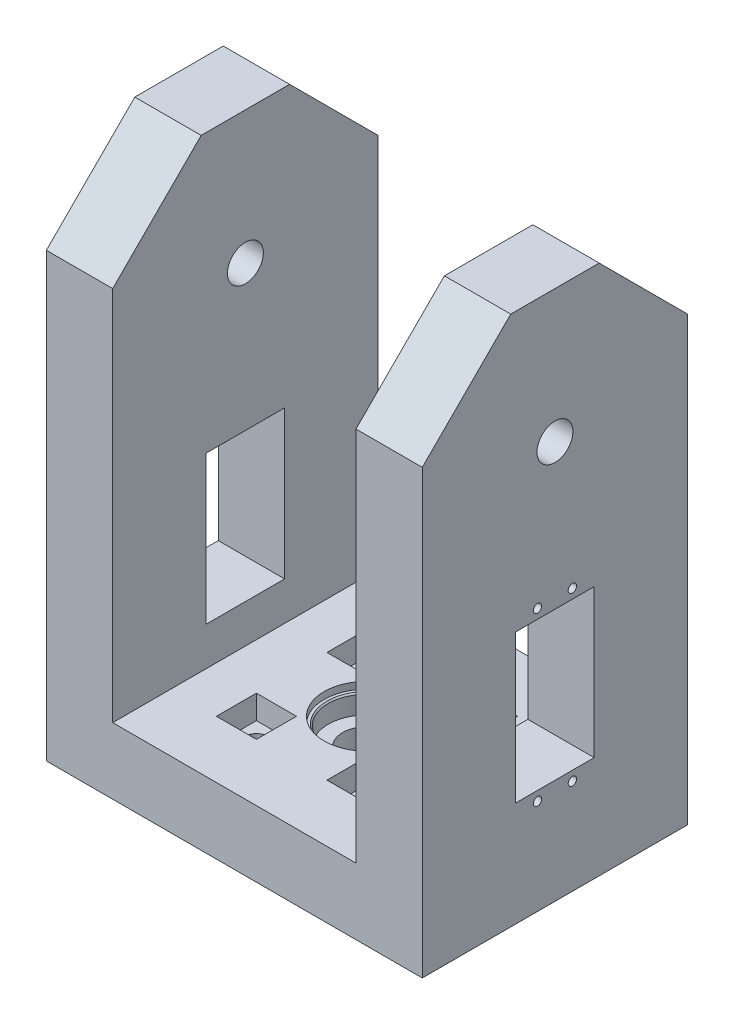
from build123d import *

# Parameters (mm, degrees)
SKETCH27_W                    = 107.95
SKETCH27_H                    = 152.4
BOSS_EXTRUDE4_DEPTH           = 38.1
CUT_EXTRUDE5_DEPTH            = 101.853114107
CUT_EXTRUDE5_DEPTH_BACK       = 101.853114107
CUT_EXTRUDE6_DEPTH            = 101.853114107
CUT_EXTRUDE6_DEPTH_BACK       = 101.853114107
SKETCH30_OUTSIDE_W            = 118.542
SKETCH30_OUTSIDE_H            = 194.742
F_3_8_CLEARANCE_HOLE4_D       = 10.31748
CUT_EXTRUDE8_REACH            = 139.518
SKETCH49_W                    = 22.54
SKETCH49_H                    = 42.54
M2_CLEARANCE_HOLE2_AT_2_COUNT = 2
M2_CLEARANCE_HOLE2_AT_2_PITCH = 10
M2_CLEARANCE_HOLE2_AT_3_COUNT = 2
M2_CLEARANCE_HOLE2_AT_3_PITCH = 49.030602689
M2_CLEARANCE_HOLE2_AT_4_COUNT = 2
M2_CLEARANCE_HOLE2_AT_4_PITCH = 48
F_1_4_CLEARANCE_HOLE1_D       = 7.14248
SKETCH53_W                    = 11.4935
SKETCH53_H                    = 11.4935
CUT_EXTRUDE9_DEPTH            = 6.8326
F_3_8_CLEARANCE_HOLE5_D       = 13.97


with BuildPart() as part:
    # Sketch27 → Boss-Extrude4 (new, symmetric)
    with BuildSketch(Plane.XY):
        Rectangle(SKETCH27_W, SKETCH27_H)
    extrude(amount=BOSS_EXTRUDE4_DEPTH, both=True)

    # Sketch28 → Cut-Extrude5 (cut, two sides: drawn at the far end of the back side and taken through both)
    with BuildSketch(Plane.XY.offset(-CUT_EXTRUDE5_DEPTH_BACK)):
        Polygon((-34.925, 439.068077332), (-34.925, 76.2), (-34.925, -57.15), (34.925, -57.15), (34.925, 76.2), (34.925, 439.068077332), (34.925, 1164.804231996), (-34.925, 1164.804231996), align=None)
    extrude(amount=CUT_EXTRUDE5_DEPTH + CUT_EXTRUDE5_DEPTH_BACK, mode=Mode.SUBTRACT)

    # Sketch30 outside → Cut-Extrude6 (cut, two sides: drawn at the far end of the back side and taken through both)
    with BuildSketch(Plane(origin=(0, 0, 0), x_dir=(0, 0, -1), z_dir=(1, 0, 0)).offset(-CUT_EXTRUDE6_DEPTH_BACK)):
        Rectangle(SKETCH30_OUTSIDE_W, SKETCH30_OUTSIDE_H)
        Polygon((-38.1, 50.8), (-38.1, -76.2), (38.1, -76.2), (38.1, 50.8), (12.7, 76.2), (-12.7, 76.2), align=None, mode=Mode.SUBTRACT)
    extrude(amount=CUT_EXTRUDE6_DEPTH + CUT_EXTRUDE6_DEPTH_BACK, mode=Mode.SUBTRACT)

    # 3/8 Clearance Hole4 (through all)
    with Locations(Plane.ZY.offset(53.975)):
        with Locations((0, 38.1)):
            Hole(F_3_8_CLEARANCE_HOLE4_D / 2)

    # Sketch49 → Cut-Extrude8 (cut, up to next)
    with BuildSketch(Plane(origin=(53.975, 0, 0), x_dir=(0, 0, -1), z_dir=(1, 0, 0)), mode=Mode.PRIVATE) as cut_extrude8_sk1:
        with Locations((0, -24.816666667)):
            Rectangle(SKETCH49_W, SKETCH49_H)
    cut_extrude8_tool1 = extrude(cut_extrude8_sk1.sketch, amount=-CUT_EXTRUDE8_REACH, mode=Mode.PRIVATE) & part.part
    cut_extrude8 = cut_extrude8_tool1.solids().sort_by_distance((53.975, -24.816667, 0))[0]
    add(cut_extrude8, mode=Mode.SUBTRACT)

    # Sketch51 → M2 Clearance Hole2 (revolve, cut)
    with BuildSketch(Plane(origin=(53.975, -48.816666667, 5), x_dir=(0, 0, -1), z_dir=(0, 1, 0))):
        Polygon((0, 0), (0, 15.721028143), (1.2, 14.9999954), (1.2, 0), align=None)
    m2_clearance_hole2 = revolve(axis=Axis((60.325, -48.816666667, 5), (-1, 0, 0)), mode=Mode.SUBTRACT)

    # M2 Clearance Hole2 at 2: M2 Clearance Hole2 ×2
    with Locations(*[(0, 0, -i * M2_CLEARANCE_HOLE2_AT_2_PITCH) for i in range(1, M2_CLEARANCE_HOLE2_AT_2_COUNT)]):
        add(m2_clearance_hole2, mode=Mode.SUBTRACT)

    # M2 Clearance Hole2 at 3: M2 Clearance Hole2 ×2
    with Locations(*[Vector(0, 0.9789804197376051, -0.20395425411200102) * (i * M2_CLEARANCE_HOLE2_AT_3_PITCH) for i in range(1, M2_CLEARANCE_HOLE2_AT_3_COUNT)]):
        add(m2_clearance_hole2, mode=Mode.SUBTRACT)

    # M2 Clearance Hole2 at 4: M2 Clearance Hole2 ×2
    with Locations(*[(0, i * M2_CLEARANCE_HOLE2_AT_4_PITCH, 0) for i in range(1, M2_CLEARANCE_HOLE2_AT_4_COUNT)]):
        add(m2_clearance_hole2, mode=Mode.SUBTRACT)

    # Mirror2: Cut-Extrude8, M2 Clearance Hole2 across plane
    add(cut_extrude8.mirror(Plane(origin=(0, 0, 0), x_dir=(0, 0, 1), z_dir=(1, 0, 0))), mode=Mode.SUBTRACT)
    add(m2_clearance_hole2.mirror(Plane(origin=(0, 0, 0), x_dir=(0, 0, 1), z_dir=(1, 0, 0))), mode=Mode.SUBTRACT)

    # Mirror2 copy 1 sketch → Mirror2 copy 1 (revolve, cut)
    with BuildSketch(Plane(origin=(-53.975, -48.816666667, -5), x_dir=(0, 0, -1), z_dir=(0, 1, 0))):
        Polygon((0, 0), (0, -15.721028143), (1.2, -14.9999954), (1.2, 0), align=None)
    revolve(axis=Axis((-60.325, -48.816666667, -5), (-1, 0, 0)), mode=Mode.SUBTRACT)

    # Mirror2 copy 2 sketch → Mirror2 copy 2 (revolve, cut)
    with BuildSketch(Plane(origin=(-53.975, -0.816666667, -5), x_dir=(0, 0, -1), z_dir=(0, 1, 0))):
        Polygon((0, 0), (0, -15.721028143), (1.2, -14.9999954), (1.2, 0), align=None)
    revolve(axis=Axis((-60.325, -0.816666667, -5), (-1, 0, 0)), mode=Mode.SUBTRACT)

    # Mirror2 copy 3 sketch → Mirror2 copy 3 (revolve, cut)
    with BuildSketch(Plane(origin=(-53.975, -0.816666667, 5), x_dir=(0, 0, -1), z_dir=(0, 1, 0))):
        Polygon((0, 0), (0, -15.721028143), (1.2, -14.9999954), (1.2, 0), align=None)
    revolve(axis=Axis((-60.325, -0.816666667, 5), (-1, 0, 0)), mode=Mode.SUBTRACT)

    # 1/4 Clearance Hole1 (through all)
    with Locations(Plane(origin=(0, -57.15, 0), x_dir=(1, 0, 0), z_dir=(0, 1, 0))):
        with Locations((-15.875, 15.875)):
            f_1_4_clearance_hole1 = Hole(F_1_4_CLEARANCE_HOLE1_D / 2)

    # Sketch53 → Cut-Extrude9 (cut)
    with BuildSketch(Plane(origin=(0, -57.15, 0), x_dir=(1, 0, 0), z_dir=(0, 1, 0))):
        with Locations((-15.875, 15.875)):
            Rectangle(SKETCH53_W, SKETCH53_H)
    cut_extrude9 = extrude(amount=-CUT_EXTRUDE9_DEPTH, mode=Mode.SUBTRACT)

    # Sketch-Pattern1: 1/4 Clearance Hole1, Cut-Extrude9 at 3 more places
    with Locations((31.75, 0, 0), (31.75, 0, 31.75), (0, 0, 31.75)):
        add(f_1_4_clearance_hole1, mode=Mode.SUBTRACT)
        add(cut_extrude9, mode=Mode.SUBTRACT)

    # 3/8 Clearance Hole5 (through all)
    with Locations(Plane(origin=(0, -57.15, 0), x_dir=(1, 0, 0), z_dir=(0, 1, 0))):
        with Locations((0, 0)):
            Hole(F_3_8_CLEARANCE_HOLE5_D / 2)


with BuildPart() as body_2:
    # uxcell-FR6ZZ: read off the stored shape, not the designer's step
    # uxcell-FR6ZZ outline → uxcell-FR6ZZ (revolve)
    with BuildSketch(Plane.XY):
        Polygon((12.303125, 7.14375), (4.7625, 7.14375), (4.7625, -0.381), (11.1125, -0.381), (11.1125, 4.778375), (11.509375, 5.17525), (12.303125, 5.17525), align=None)
    revolve(axis=Axis((0, 0, 0), (0, 1, 0)))


with BuildPart() as body_2_1:
    # Body-Move/Copy2: read off the stored shape, not the designer's step
    # Body-Move/Copy2: moved
    add(body_2.part.moved(Location((0, -64.29375, 0))))


with BuildPart() as part_1:
    add(part.part)

    # Combine1: cut body 2
    add(body_2_1.part, mode=Mode.SUBTRACT)


solid = part_1.part
